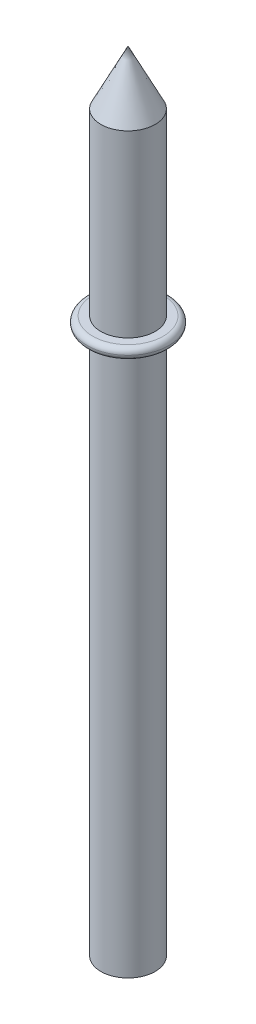
from build123d import *

# Parameters (mm, degrees)
SKETCH1_R           = 5
BOSS_EXTRUDE1_DEPTH = 135
BOSS_EXTRUDE2_START = -100
SKETCH3_R           = 7.5
SKETCH3_R_2         = 5
BOSS_EXTRUDE2_DEPTH = 2
FILLET1_R           = 1


with BuildPart() as part:
    # Sketch1 → Boss-Extrude1 (new body)
    with BuildSketch(Plane(origin=(0, 0, 0), x_dir=(1, 0, 0), z_dir=(0, 1, 0))):
        with Locations(Location((0, 0, 0), (0, 0, 270))):
            Circle(SKETCH1_R)
    extrude(amount=BOSS_EXTRUDE1_DEPTH)

    # Sketch2 → Revolve3 (revolve)
    with BuildSketch(Plane.XY, mode=Mode.PRIVATE) as revolve3_sk:
        Polygon((0, 145), (5, 135), (0, 135), align=None)
    revolve(revolve3_sk.sketch.rotate(Axis((0, 135, 0), (0, -1, 0)), 270), axis=Axis((0, 135, 0), (0, -1, 0)))

    # Sketch3 → Boss-Extrude2 (add)
    with BuildSketch(Plane.XZ.offset(BOSS_EXTRUDE2_START)):
        with Locations(Location((0, 0, 0), (0, 0, 270))):
            Circle(SKETCH3_R)
        with Locations(Location((0, 0, 0), (0, 0, 270))):
            Circle(SKETCH3_R_2, mode=Mode.SUBTRACT)
    extrude(amount=-BOSS_EXTRUDE2_DEPTH)

    # Fillet1
    fillet1_edges = [part.edges().sort_by_distance(p)[0] for p in [
        (0, 100, 7.5),
        (0, 102, 7.5),
    ]]
    fillet(fillet1_edges, radius=FILLET1_R - 0.0001)  # a hair under: the kernel refuses the full size


solid = part.part
